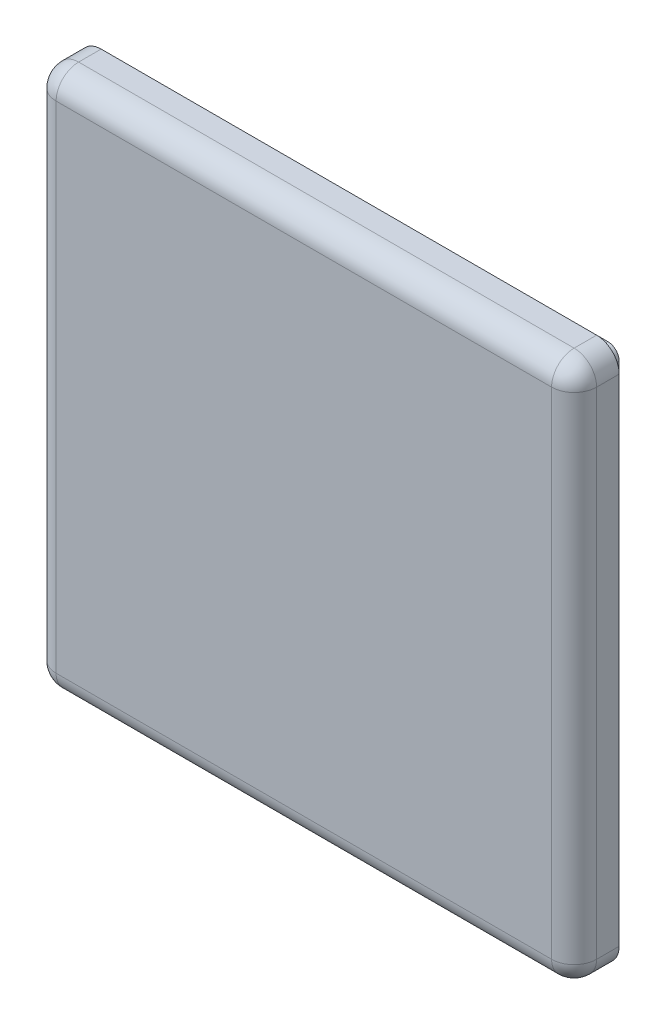
from build123d import *

# Parameters (mm, degrees)
SKETCH1_W           = 24
SKETCH1_H           = 24
BOSS_EXTRUDE1_DEPTH = 2
SKETCH2_W           = 22
SKETCH2_H           = 22
SKETCH2_W_2         = 20
SKETCH2_H_2         = 20
BOSS_EXTRUDE2_DEPTH = 1
FILLET1_R           = 1
FILLET2_R           = 1
FILLET3_R           = 0.5


with BuildPart() as part:
    # Sketch1 → Boss-Extrude1 (new body)
    with BuildSketch(Plane.XY):
        Rectangle(SKETCH1_W, SKETCH1_H)
    extrude(amount=BOSS_EXTRUDE1_DEPTH)

    # Sketch2 → Boss-Extrude2 (add)
    with BuildSketch(Plane(origin=(0, 0, 0), x_dir=(-1, 0, 0), z_dir=(0, 0, -1))):
        Rectangle(SKETCH2_W, SKETCH2_H)
        Rectangle(SKETCH2_W_2, SKETCH2_H_2, mode=Mode.SUBTRACT)
    extrude(amount=BOSS_EXTRUDE2_DEPTH)

    # Fillet1
    fillet1_edges = [part.edges().sort_by_distance(p)[0] for p in [
        (-12, 0, 2),
        (0, -12, 2),
        (12, 0, 2),
        (0, 12, 2),
    ]]
    fillet(fillet1_edges, radius=FILLET1_R)

    # Fillet2
    # the kernel refuses this fillet: 1 mm, written as the material it takes off along each edge
    with BuildSketch(Plane(origin=(-11, -11, 1), x_dir=(-1, 0, 0), z_dir=(0, -1, 0))) as fillet2_piece_1_section:
        Polygon((0, 0), (FILLET2_R, 0), (FILLET2_R, -FILLET2_R), (0, -FILLET2_R), align=None)
    fillet2_piece_1 = extrude(amount=FILLET2_R, mode=Mode.PRIVATE)
    fillet2_piece_1 = fillet2_piece_1 - Plane(origin=(-11, -11, 1), x_dir=(0.7071067811865475, 0, -0.7071067811865475), z_dir=(0, -1, 0)) * Sphere(FILLET2_R, mode=Mode.PRIVATE)
    add(fillet2_piece_1, mode=Mode.SUBTRACT)
    with BuildSketch(Plane(origin=(-11, 11, 1), x_dir=(0, 1, 0), z_dir=(-1, 0, 0))) as fillet2_piece_2_section:
        Polygon((0, 0), (FILLET2_R, 0), (FILLET2_R, -FILLET2_R), (0, -FILLET2_R), align=None)
    fillet2_piece_2 = extrude(amount=FILLET2_R, mode=Mode.PRIVATE)
    fillet2_piece_2 = fillet2_piece_2 - Plane(origin=(-11, 11, 1), x_dir=(0, -0.7071067811865475, -0.7071067811865475), z_dir=(-1, 0, 0)) * Sphere(FILLET2_R, mode=Mode.PRIVATE)
    add(fillet2_piece_2, mode=Mode.SUBTRACT)
    with BuildSketch(Plane(origin=(11, -11, 1), x_dir=(1, 0, 0), z_dir=(0, -1, 0))) as fillet2_piece_3_section:
        Polygon((0, 0), (FILLET2_R, 0), (FILLET2_R, FILLET2_R), (0, FILLET2_R), align=None)
    fillet2_piece_3 = extrude(amount=FILLET2_R, mode=Mode.PRIVATE)
    fillet2_piece_3 = fillet2_piece_3 - Plane(origin=(11, -11, 1), x_dir=(-0.7071067811865475, 0, -0.7071067811865475), z_dir=(0, -1, 0)) * Sphere(FILLET2_R, mode=Mode.PRIVATE)
    add(fillet2_piece_3, mode=Mode.SUBTRACT)
    with BuildSketch(Plane(origin=(11, 11, 1), x_dir=(0, 1, 0), z_dir=(1, 0, 0))) as fillet2_piece_4_section:
        Polygon((0, 0), (FILLET2_R, 0), (FILLET2_R, FILLET2_R), (0, FILLET2_R), align=None)
    fillet2_piece_4 = extrude(amount=FILLET2_R, mode=Mode.PRIVATE)
    fillet2_piece_4 = fillet2_piece_4 - Plane(origin=(11, 11, 1), x_dir=(0, -0.7071067811865475, -0.7071067811865475), z_dir=(1, 0, 0)) * Sphere(FILLET2_R, mode=Mode.PRIVATE)
    add(fillet2_piece_4, mode=Mode.SUBTRACT)
    with BuildSketch(Plane(origin=(12, 12, -2.5), x_dir=(0, -1, 0), z_dir=(0, 0, 1)), Plane(origin=(12, -12, -2.5), x_dir=(-1, 0, 0), z_dir=(0, 0, 1))) as fillet2_piece_5:
        with BuildLine():
            CenterArc((FILLET2_R, -FILLET2_R), FILLET2_R, 90, 90)
            Line((0, -FILLET2_R), (0, 0))
            Line((0, 0), (FILLET2_R, 0))
        make_face()
    extrude(amount=3.5, mode=Mode.SUBTRACT)
    with BuildSketch(Plane(origin=(-12, -12, -2.5), x_dir=(1, 0, 0), z_dir=(0, 0, 1)), Plane(origin=(-12, 12, -2.5), x_dir=(0, -1, 0), z_dir=(0, 0, 1))) as fillet2_piece_6:
        with BuildLine():
            CenterArc((FILLET2_R, FILLET2_R), FILLET2_R, 180, 90)
            Line((0, FILLET2_R), (0, 0))
            Line((0, 0), (FILLET2_R, 0))
        make_face()
    extrude(amount=3.5, mode=Mode.SUBTRACT)

    # Fillet3
    fillet3_edges = [part.edges().sort_by_distance(p)[0] for p in [
        (-11, -11, -0.5),
        (-11, 11, -0.5),
        (11, 11, -0.5),
        (11, -11, -0.5),
    ]]
    fillet(fillet3_edges, radius=FILLET3_R)


solid = part.part
